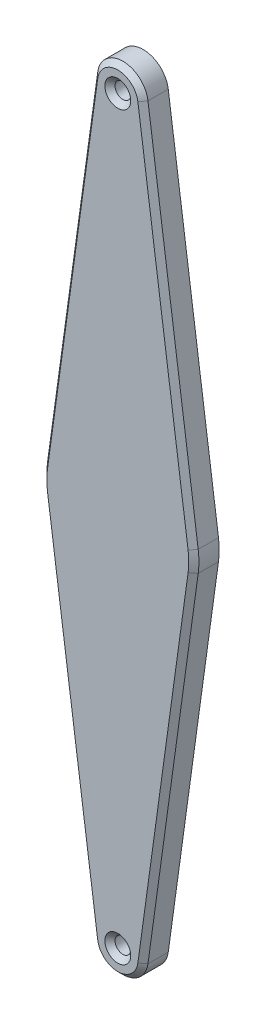
from build123d import *

# Parameters (mm, degrees)
BOSS_EXTRUDE1_DEPTH      = 5
CHAMFER1_SIZE            = 1
CUT_EXTRUDE2_REACH       = 179.034
SKETCH6_R                = 1.55
CHAMFER3_SIZE            = 1
CHAMFER3_OF_MIRROR2_SIZE = 1


with BuildPart() as part:
    # Sketch1 → Boss-Extrude1 (new body)
    with BuildSketch(Plane.XY):
        with BuildLine():
            ThreePointArc((99.858594129, 65.945205479), (100, 68), (99.858594129, 70.054794521))
            Line((99.858594129, 70.054794521), (89.95286471, 141.684931507))
            ThreePointArc((89.95286471, 141.684931507), (85, 146), (80.04713529, 141.684931507))
            Line((80.04713529, 141.684931507), (70.141405871, 70.054794521))
            ThreePointArc((70.141405871, 70.054794521), (70, 68), (70.141405871, 65.945205479))
            Line((70.141405871, 65.945205479), (80.04713529, -5.684931507))
            ThreePointArc((80.04713529, -5.684931507), (85, -10), (89.95286471, -5.684931507))
            Line((89.95286471, -5.684931507), (99.858594129, 65.945205479))
        make_face()
    extrude(amount=BOSS_EXTRUDE1_DEPTH)

    # Chamfer1
    chamfer1_edges = [part.edges().sort_by_distance(p)[0] for p in [
        (75.094270581, 30.130136986, 5),
        (70, 68, 5),
        (75.094270581, 105.869863014, 5),
        (85, 146, 5),
        (94.905729419, 105.869863014, 5),
        (100, 68, 5),
        (94.905729419, 30.130136986, 5),
        (85, -10, 5),
    ]]
    chamfer(chamfer1_edges, length=CHAMFER1_SIZE)

    # Sketch6 → Cut-Extrude2 (cut, up to next)
    with BuildSketch(Plane.XY.offset(5), mode=Mode.PRIVATE) as cut_extrude2_sk1:
        with Locations((85, 141)):
            Circle(SKETCH6_R)
    cut_extrude2_tool1 = extrude(cut_extrude2_sk1.sketch, amount=-CUT_EXTRUDE2_REACH, mode=Mode.PRIVATE) & part.part
    cut_extrude2 = cut_extrude2_tool1.solids().sort_by_distance((85, 141, 5))[0]
    add(cut_extrude2, mode=Mode.SUBTRACT)

    # Chamfer3
    chamfer3_edges = [part.edges().sort_by_distance(p)[0] for p in [
        (83.45, 141, 5),
    ]]
    chamfer(chamfer3_edges, length=CHAMFER3_SIZE)

    # Mirror2: Cut-Extrude2 across plane
    add(cut_extrude2.mirror(Plane(origin=(0, 68, 0), x_dir=(0, 0, 1), z_dir=(0, -1, 0))), mode=Mode.SUBTRACT)

    # Chamfer3 of Mirror2
    chamfer3_of_mirror2_edges = [part.edges().sort_by_distance(p)[0] for p in [
        (83.45, -5, 5),
    ]]
    chamfer(chamfer3_of_mirror2_edges, length=CHAMFER3_OF_MIRROR2_SIZE)


solid = part.part
